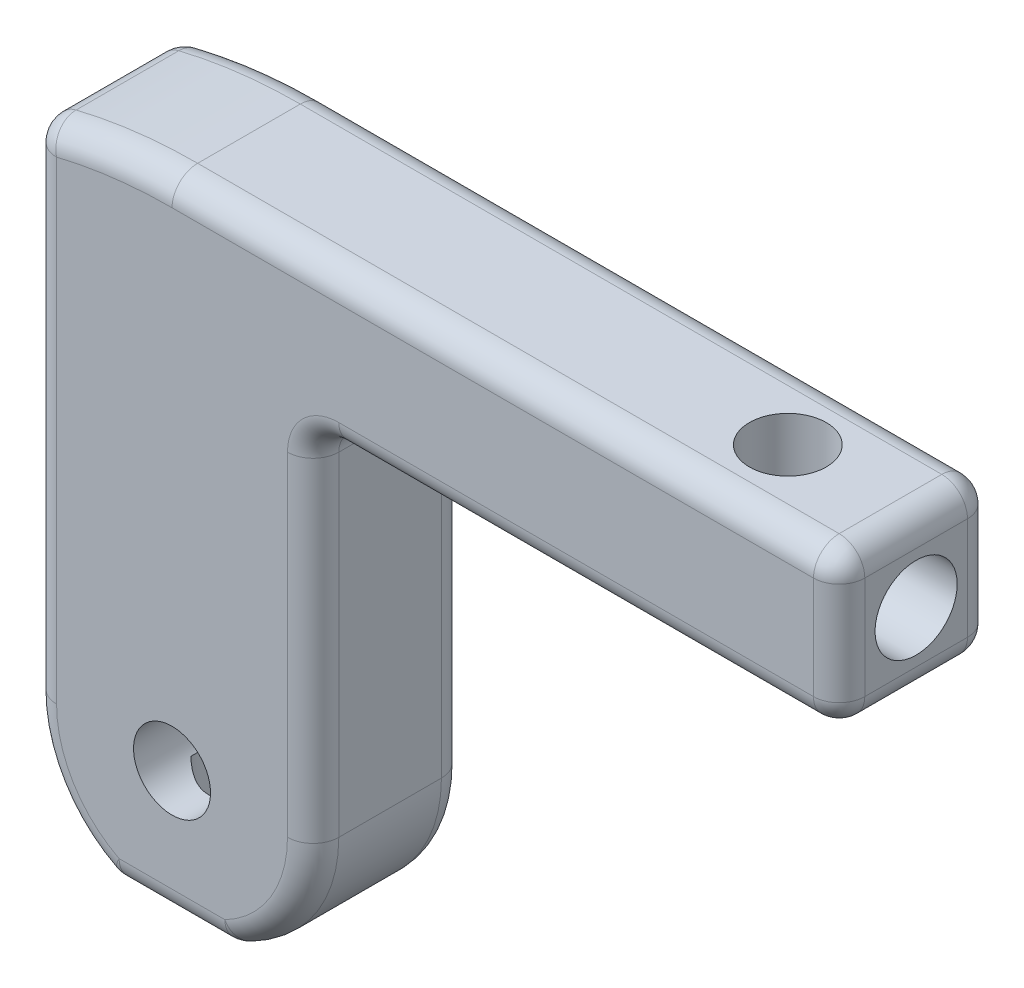
from build123d import *

# Parameters (mm, degrees)
SKETCH_1_W          = 11
SKETCH_1_H          = 20
EXTRUDE_1_DEPTH     = 6
CUT_EXTRUDE_1_DEPTH = 6
SKETCH_3_R          = 5.5
EXTRUDE_2_DEPTH     = 6
SKETCH_4_W          = 24
SKETCH_4_H          = 6
EXTRUDE_3_DEPTH     = 6
SKETCH_6_R          = 1.5
CUT_EXTRUDE_3_DEPTH = 6
SKETCH_7_R          = 1.5
CUT_EXTRUDE_4_DEPTH = 6
SKETCH_5_W          = 6
SKETCH_5_H          = 0.5
CUT_EXTRUDE_5_DEPTH = 10
SKETCH_15_W         = 6
SKETCH_15_H         = 6
EXTRUDE_4_DEPTH     = 2
FILLET_2_R          = 1
SKETCH_16_R         = 1.6
CUT_EXTRUDE_7_DEPTH = 4
SKETCH_14_R         = 1.6
CUT_EXTRUDE_8_DEPTH = 4


# Read off the part's stored shape, not the designer's step: 切除-拉伸1
with BuildPart() as part:
    # 草图1 → 凸台-拉伸1 (new body)
    with BuildSketch(Plane.XY):
        with Locations((5.5, 10)):
            Rectangle(SKETCH_1_W, SKETCH_1_H)
    extrude(amount=EXTRUDE_1_DEPTH)

    # 切除-拉伸1 outline → 切除-拉伸1 (cut)
    with BuildSketch(Plane.XY):
        with BuildLine():
            Line((0, 20), (0, 19.228884523))
            ThreePointArc((0, 19.228884523), (2.723103392, 19.806282974), (5.5, 20))
            Line((5.5, 20), (0, 20))
        make_face()
        with BuildLine():
            Line((11, 20), (5.5, 20))
            ThreePointArc((5.5, 20), (8.276896608, 19.806282974), (11, 19.228884523))
            Line((11, 19.228884523), (11, 20))
        make_face()
    extrude(amount=CUT_EXTRUDE_1_DEPTH, mode=Mode.SUBTRACT)

    # 草图3 → 凸台-拉伸2 (add)
    with BuildSketch(Plane.XY):
        with Locations((5.5, 0)):
            Circle(SKETCH_3_R)
    extrude(amount=EXTRUDE_2_DEPTH)

    # 草图4 → 凸台-拉伸3 (add)
    with BuildSketch(Plane.XY):
        with Locations((17.5, 17)):
            Rectangle(SKETCH_4_W, SKETCH_4_H)
    extrude(amount=EXTRUDE_3_DEPTH)

    # 草图6 → 切除-拉伸3 (cut)
    with BuildSketch(Plane.XY):
        with Locations((5.5, 0)):
            Circle(SKETCH_6_R)
    extrude(amount=CUT_EXTRUDE_3_DEPTH, mode=Mode.SUBTRACT)

    # 草图7 → 切除-拉伸4 (cut)
    with BuildSketch(Plane.XZ.offset(-14)):
        with Locations((26.5, 3)):
            Circle(SKETCH_7_R)
    extrude(amount=-CUT_EXTRUDE_4_DEPTH, mode=Mode.SUBTRACT)

    # 草图5 → 切除-拉伸5 (cut)
    with BuildSketch(Plane.XY):
        with Locations((5.5, -5.25)):
            Rectangle(SKETCH_5_W, SKETCH_5_H)
    extrude(amount=CUT_EXTRUDE_5_DEPTH, mode=Mode.SUBTRACT)

    # 草图15 → 凸台-拉伸4 (add)
    with BuildSketch(Plane(origin=(29.5, 0, 0), x_dir=(0, 0, -1), z_dir=(1, 0, 0))):
        with Locations((-3, 17)):
            Rectangle(SKETCH_15_W, SKETCH_15_H)
    extrude(amount=EXTRUDE_4_DEPTH)

    # 圆角2
    fillet_2_edges = [part.edges().sort_by_distance(p)[0] for p in [
        (31.5, 17, 0),
        (31.5, 20, 3),
        (31.5, 17, 6),
        (31.5, 14, 3),
        (11, 7, 6),
        (0, 9.614442262, 0),
        (0, 9.614442262, 6),
        (0, 19.228884523, 3),
        (0.871172764, -2.970514841, 0),
        (0.871172764, -2.970514841, 6),
        (2.723103392, 19.806282974, 6),
        (2.723103392, 19.806282974, 0),
        (11, 14, 3),
        (11, 7, 0),
        (21.25, 14, 0),
        (21.25, 14, 6),
        (18.5, 20, 6),
        (18.5, 20, 0),
        (10.128827236, -2.970514841, 6),
        (10.128827236, -2.970514841, 0),
        (7.791287847, -5, 3),
        (3.208712153, -5, 3),
        (5.5, -5, 0),
        (5.5, -5, 6),
    ]]
    fillet(fillet_2_edges, radius=FILLET_2_R)

    # 草图16 → 切除-拉伸7 (cut)
    with BuildSketch(Plane(origin=(31.5, 0, 0), x_dir=(0, 0, -1), z_dir=(1, 0, 0))):
        with Locations((-3, 17)):
            Circle(SKETCH_16_R)
    extrude(amount=-CUT_EXTRUDE_7_DEPTH, mode=Mode.SUBTRACT)

    # 草图14 → 切除-拉伸8 (cut)
    with BuildSketch(Plane(origin=(0, -5, 0), x_dir=(-1, 0, 0), z_dir=(0, -1, 0))):
        with Locations(Location((-5.5, -3, 0), (0, 0, 90))):
            Circle(SKETCH_14_R)
    extrude(amount=-CUT_EXTRUDE_8_DEPTH, mode=Mode.SUBTRACT)


solid = part.part
